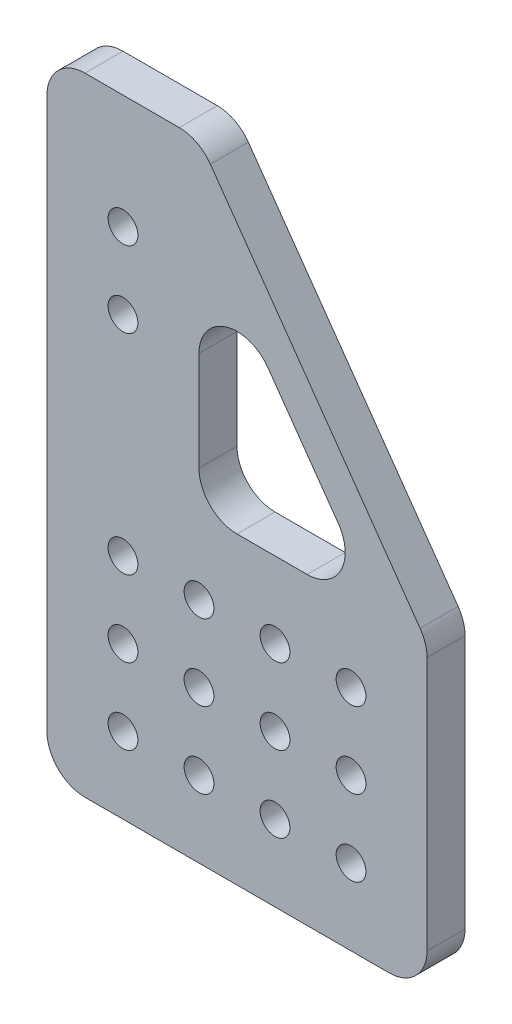
from build123d import *

# Parameters (mm, degrees)
SKETCH1_R           = 2.4892
BOSS_EXTRUDE1_DEPTH = 3.175
LPATTERN1_START     = -3.175
LPATTERN1_OUTLINE_R = 2.4892
LPATTERN1_DEPTH     = 6.35
CUT_EXTRUDE1_DEPTH  = 123.679962198
FILLET1_R           = 6.35


# Read off the part's stored shape, not the designer's step: LPattern1
with BuildPart() as part:
    # Sketch1 → Boss-Extrude1 (new, symmetric)
    with BuildSketch(Plane.XY):
        Polygon((0, 0), (0, 104.775), (25.4, 104.775), (63.5, 50.8), (63.5, 0), align=None)
        with Locations((12.7, 85.725)):
            Circle(SKETCH1_R, mode=Mode.SUBTRACT)
        with Locations((12.7, 73.025)):
            Circle(SKETCH1_R, mode=Mode.SUBTRACT)
        with Locations((12.7, 12.7)):
            Circle(SKETCH1_R, mode=Mode.SUBTRACT)
    extrude(amount=BOSS_EXTRUDE1_DEPTH, both=True)

    # LPattern1 outline → LPattern1 (cut)
    with BuildSketch(Plane.XY.offset(LPATTERN1_START)):
        with Locations((50.8, 38.1)):
            Circle(LPATTERN1_OUTLINE_R)
        with Locations((38.1, 38.1)):
            Circle(LPATTERN1_OUTLINE_R)
        with Locations((25.4, 38.1)):
            Circle(LPATTERN1_OUTLINE_R)
        with Locations((12.7, 38.1)):
            Circle(LPATTERN1_OUTLINE_R)
        with Locations((50.8, 25.4)):
            Circle(LPATTERN1_OUTLINE_R)
        with Locations((38.1, 25.4)):
            Circle(LPATTERN1_OUTLINE_R)
        with Locations((25.4, 25.4)):
            Circle(LPATTERN1_OUTLINE_R)
        with Locations((12.7, 25.4)):
            Circle(LPATTERN1_OUTLINE_R)
        with Locations((50.8, 12.7)):
            Circle(LPATTERN1_OUTLINE_R)
        with Locations((38.1, 12.7)):
            Circle(LPATTERN1_OUTLINE_R)
        with Locations((25.4, 12.7)):
            Circle(LPATTERN1_OUTLINE_R)
    extrude(amount=LPATTERN1_DEPTH, mode=Mode.SUBTRACT)

    # Sketch2 → Cut-Extrude1 (cut, through all)
    with BuildSketch(Plane.XY.offset(3.175)):
        Polygon((25.4, 93.763754959), (25.4, 50.8), (55.727356441, 50.8), align=None)
    extrude(amount=-CUT_EXTRUDE1_DEPTH, mode=Mode.SUBTRACT)

    # Fillet1
    fillet1_edges = [part.edges().sort_by_distance(p)[0] for p in [
        (55.727356441, 50.8, 0),
        (25.4, 50.8, 0),
        (25.4, 93.763754959, 0),
        (0, 0, 0),
        (0, 104.775, 0),
        (25.4, 104.775, 0),
        (63.5, 50.8, 0),
        (63.5, 0, 0),
    ]]
    fillet(fillet1_edges, radius=FILLET1_R)


solid = part.part
